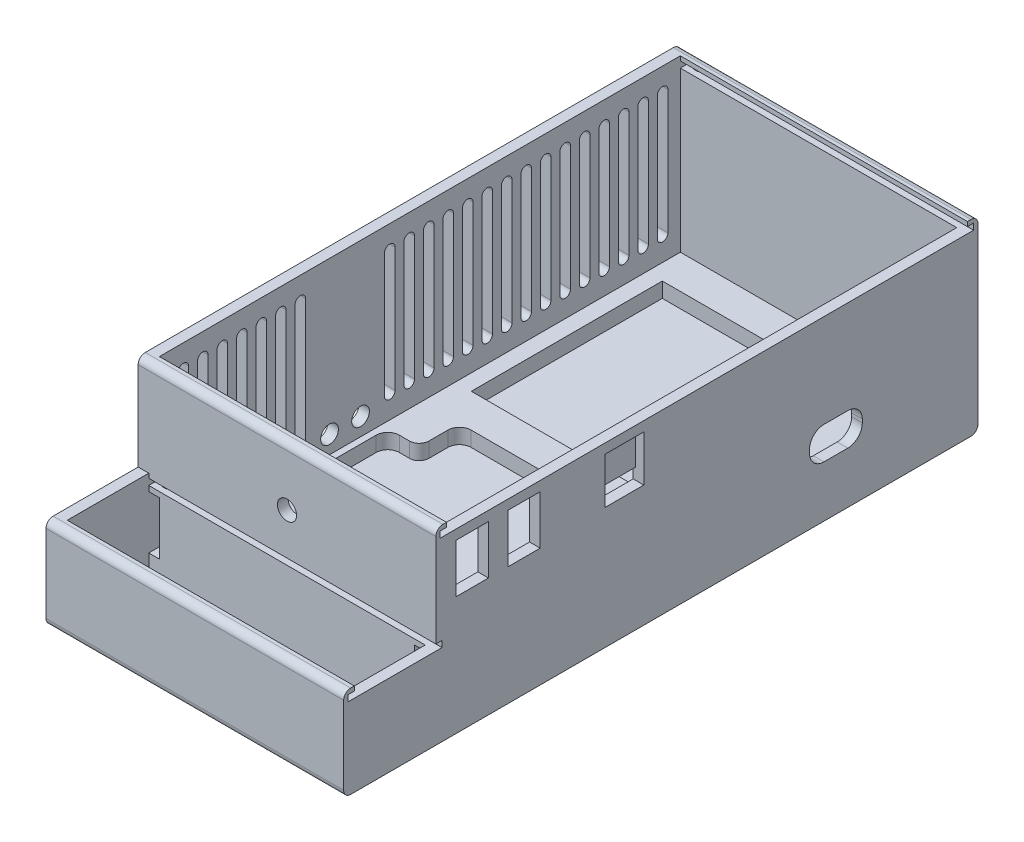
from build123d import *

# Parameters (mm, degrees)
SKETCH1_W            = 100
SKETCH1_H            = 187
BOSS_EXTRUDE1_DEPTH  = 5
SKETCH2_W            = 78
SKETCH2_H            = 23
CUT_EXTRUDE1_DEPTH   = 2.5
SKETCH3_W            = 84
SKETCH3_H            = 29
SKETCH3_W_2          = 78
SKETCH3_H_2          = 23
BOSS_EXTRUDE2_DEPTH  = 18
CUT_EXTRUDE2_DEPTH   = 4.25
CUT_EXTRUDE3_DEPTH   = 0.5
SKETCH8_W            = 3
SKETCH8_H            = 15
CUT_EXTRUDE4_DEPTH   = 3
SKETCH9_W            = 29
SKETCH9_H            = 3
BOSS_EXTRUDE4_DEPTH  = 3
BOSS_EXTRUDE5_DEPTH  = 81
CUT_EXTRUDE5_DEPTH   = 5
BOSS_EXTRUDE6_DEPTH  = 45
SKETCH14_W           = 68.5
SKETCH14_H           = 53.4
CUT_EXTRUDE6_DEPTH   = 4.25
SKETCH15_W           = 84
SKETCH15_H           = 3
BOSS_EXTRUDE7_DEPTH  = 24
BOSS_EXTRUDE8_DEPTH  = 3
SKETCH19_W           = 1.75
SKETCH19_H           = 1.75
CUT_EXTRUDE8_DEPTH   = 81
SKETCH23_W           = 1.75
SKETCH23_H           = 1.25
BOSS_EXTRUDE9_DEPTH  = 0.4
FILLET2_R            = 0.4
SKETCH40_W           = 1.75
SKETCH40_H           = 1.25
BOSS_EXTRUDE14_DEPTH = 0.4
FILLET6_R            = 0.4
SKETCH25_W           = 1.75
SKETCH25_H           = 1.25
BOSS_EXTRUDE11_DEPTH = 0.4
FILLET4_R            = 0.4
SKETCH26_W           = 1.75
SKETCH26_H           = 1.25
BOSS_EXTRUDE12_DEPTH = 0.4
FILLET5_R            = 0.4
SKETCH27_W           = 10.45
SKETCH27_H           = 12.5
CUT_EXTRUDE10_DEPTH  = 3
SKETCH29_W           = 8.6
SKETCH29_H           = 13.3
CUT_EXTRUDE11_DEPTH  = 3
SKETCH30_R           = 2.5
CUT_EXTRUDE12_DEPTH  = 3
CUT_EXTRUDE13_DEPTH  = 3
SKETCH33_R           = 2.5
CUT_EXTRUDE15_DEPTH  = 3
SKETCH34_W           = 69
SKETCH34_H           = 53.9
CUT_EXTRUDE16_DEPTH  = 4.25
SKETCH36_W           = 10.95
SKETCH36_H           = 13
SKETCH36_W_2         = 9.1
SKETCH36_H_2         = 13.8
CUT_EXTRUDE18_DEPTH  = 3
SKETCH37_R           = 2.7
CUT_EXTRUDE19_DEPTH  = 3
SKETCH38_W           = 10.95
SKETCH38_H           = 9.86
BOSS_EXTRUDE13_DEPTH = 0.6
CUT_EXTRUDE20_DEPTH  = 3
FILLET18_R           = 2


with BuildPart() as part:
    # Sketch1 → Boss-Extrude1 (new body)
    with BuildSketch(Plane(origin=(0, 0, 0), x_dir=(1, 0, 0), z_dir=(0, 1, 0))):
        with Locations((50, 93.5)):
            Rectangle(SKETCH1_W, SKETCH1_H)
    extrude(amount=-BOSS_EXTRUDE1_DEPTH)

    # Sketch2 → Cut-Extrude1 (cut)
    with BuildSketch(Plane(origin=(0, 0, 0), x_dir=(1, 0, 0), z_dir=(0, 1, 0))):
        with Locations((50, 22.5)):
            Rectangle(SKETCH2_W, SKETCH2_H)
    extrude(amount=-CUT_EXTRUDE1_DEPTH, mode=Mode.SUBTRACT)

    # Sketch3 → Boss-Extrude2 (add)
    with BuildSketch(Plane(origin=(0, 0, 0), x_dir=(1, 0, 0), z_dir=(0, 1, 0))):
        with Locations((50, 22.5)):
            Rectangle(SKETCH3_W, SKETCH3_H)
        with Locations((50, 22.5)):
            Rectangle(SKETCH3_W_2, SKETCH3_H_2, mode=Mode.SUBTRACT)
    extrude(amount=BOSS_EXTRUDE2_DEPTH)

    # Sketch4 → Cut-Extrude2 (cut)
    with BuildSketch(Plane(origin=(0, 0, 0), x_dir=(1, 0, 0), z_dir=(0, 1, 0))):
        with BuildLine():
            Line((31.915, 47), (76.965, 47))
            ThreePointArc((76.965, 47), (84.036067812, 49.928932188), (86.965, 57))
            Line((86.965, 57), (86.965, 100.77))
            ThreePointArc((86.965, 100.77), (84.036067812, 107.841067812), (76.965, 110.77))
            Line((76.965, 110.77), (24.915, 110.77))
            ThreePointArc((24.915, 110.77), (22.793679656, 109.891320344), (21.915, 107.77))
            Line((21.915, 107.77), (21.915, 102.4))
            ThreePointArc((21.915, 102.4), (21.036320344, 100.278679656), (18.915, 99.4))
            Line((18.915, 99.4), (16.035, 99.4))
            ThreePointArc((16.035, 99.4), (13.913679656, 98.521320344), (13.035, 96.4))
            Line((13.035, 96.4), (13.035, 82.01))
            ThreePointArc((13.035, 82.01), (13.913679656, 79.888679656), (16.035, 79.01))
            Line((16.035, 79.01), (18.915, 79.01))
            ThreePointArc((18.915, 79.01), (21.036320344, 78.131320344), (21.915, 76.01))
            Line((21.915, 76.01), (21.915, 57))
            ThreePointArc((21.915, 57), (24.843932188, 49.928932188), (31.915, 47))
        make_face()
    extrude(amount=-CUT_EXTRUDE2_DEPTH, mode=Mode.SUBTRACT)

    # Sketch7 → Cut-Extrude3 (cut)
    with BuildSketch(Plane(origin=(0, -2.5, 0), x_dir=(1, 0, 0), z_dir=(0, 1, 0))):
        Polygon((11, 34), (34, 11), (32.978260085, 11), (11, 32.978260085), align=None)
        Polygon((12, 34), (35, 11), (36, 11), (13, 34), align=None)
        Polygon((11, 11), (11.521721863, 11), (11, 11.521721863), align=None)
        Polygon((89, 34), (89, 33), (88, 34), align=None)
        Polygon((14, 34), (37, 11), (38, 11), (15, 34), align=None)
        Polygon((16, 34), (39, 11), (40, 11), (17, 34), align=None)
        Polygon((18, 34), (41, 11), (42, 11), (19, 34), align=None)
        Polygon((20, 34), (43, 11), (44, 11), (21, 34), align=None)
        Polygon((22, 34), (45, 11), (46, 11), (23, 34), align=None)
        Polygon((24, 34), (47, 11), (48, 11), (25, 34), align=None)
        Polygon((26, 34), (49, 11), (50, 11), (27, 34), align=None)
        Polygon((28, 34), (51, 11), (52, 11), (29, 34), align=None)
        Polygon((30, 34), (53, 11), (54, 11), (31, 34), align=None)
        Polygon((32, 34), (55, 11), (56, 11), (33, 34), align=None)
        Polygon((34, 34), (57, 11), (58, 11), (35, 34), align=None)
        Polygon((36, 34), (59, 11), (60, 11), (37, 34), align=None)
        Polygon((38, 34), (61, 11), (62, 11), (39, 34), align=None)
        Polygon((40, 34), (63, 11), (64, 11), (41, 34), align=None)
        Polygon((42, 34), (65, 11), (66, 11), (43, 34), align=None)
        Polygon((44, 34), (67, 11), (68, 11), (45, 34), align=None)
        Polygon((46, 34), (69, 11), (70, 11), (47, 34), align=None)
        Polygon((48, 34), (71, 11), (72, 11), (49, 34), align=None)
        Polygon((50, 34), (73, 11), (74, 11), (51, 34), align=None)
        Polygon((52, 34), (75, 11), (76, 11), (53, 34), align=None)
        Polygon((54, 34), (77, 11), (78, 11), (55, 34), align=None)
        Polygon((56, 34), (79, 11), (80, 11), (57, 34), align=None)
        Polygon((58, 34), (81, 11), (82, 11), (59, 34), align=None)
        Polygon((60, 34), (83, 11), (84, 11), (61, 34), align=None)
        Polygon((62, 34), (85, 11), (86, 11), (63, 34), align=None)
        Polygon((64, 34), (87, 11), (88, 11), (65, 34), align=None)
        Polygon((66, 34), (89, 11), (89, 12), (67, 34), align=None)
        Polygon((68, 34), (89, 13), (89, 14), (69, 34), align=None)
        Polygon((70, 34), (89, 15), (89, 16), (71, 34), align=None)
        Polygon((72, 34), (89, 17), (89, 18), (73, 34), align=None)
        Polygon((74, 34), (89, 19), (89, 20), (75, 34), align=None)
        Polygon((76, 34), (89, 21), (89, 22), (77, 34), align=None)
        Polygon((78, 34), (89, 23), (89, 24), (79, 34), align=None)
        Polygon((80, 34), (89, 25), (89, 26), (81, 34), align=None)
        Polygon((82, 34), (89, 27), (89, 28), (83, 34), align=None)
        Polygon((84, 34), (89, 29), (89, 30), (85, 34), align=None)
        Polygon((86, 34), (89, 31), (89, 32), (87, 34), align=None)
        Polygon((11, 31.956520169), (31.956520169, 11), (30.934780254, 11), (11, 30.934780254), align=None)
        Polygon((11, 29.913040339), (29.913040339, 11), (28.891300423, 11), (11, 28.891300423), align=None)
        Polygon((11, 27.869560508), (27.869560508, 11), (26.847820593, 11), (11, 26.847820593), align=None)
        Polygon((11, 25.826080677), (25.826080677, 11), (24.804340762, 11), (11, 24.804340762), align=None)
        Polygon((11, 23.782600847), (23.782600847, 11), (22.760860931, 11), (11, 22.760860931), align=None)
        Polygon((11, 21.739121016), (21.739121016, 11), (20.717381101, 11), (11, 20.717381101), align=None)
        Polygon((11, 19.695641185), (19.695641185, 11), (18.67390127, 11), (11, 18.67390127), align=None)
        Polygon((11, 17.652161355), (17.652161355, 11), (16.630421439, 11), (11, 16.630421439), align=None)
        Polygon((11, 15.608681524), (15.608681524, 11), (14.586941609, 11), (11, 14.586941609), align=None)
        Polygon((11, 13.565201693), (13.565201693, 11), (12.543461778, 11), (11, 12.543461778), align=None)
    extrude(amount=-CUT_EXTRUDE3_DEPTH, mode=Mode.SUBTRACT)

    # Sketch8 → Cut-Extrude4 (cut)
    with BuildSketch(Plane(origin=(0, 0, -37), x_dir=(-1, 0, 0), z_dir=(0, 0, -1))):
        with Locations((-87.5, 9)):
            Rectangle(SKETCH8_W, SKETCH8_H)
        with Locations((-12.5, 9)):
            Rectangle(SKETCH8_W, SKETCH8_H)
    extrude(amount=-CUT_EXTRUDE4_DEPTH, mode=Mode.SUBTRACT)

    # Sketch9 → Boss-Extrude4 (add)
    with BuildSketch(Plane.ZY.offset(-8)):
        with Locations((-22.5, 19.5)):
            Rectangle(SKETCH9_W, SKETCH9_H)
    extrude(amount=-BOSS_EXTRUDE4_DEPTH)

    # Sketch10 → Boss-Extrude5 (add)
    with BuildSketch(Plane(origin=(11, 0, 0), x_dir=(0, 0, -1), z_dir=(1, 0, 0))):
        Polygon((9.25, 18), (8, 18), (8, 21), (11, 21), (11, 19.75), (9.25, 19.75), align=None)
        Polygon((35.75, 19.75), (35.75, 18), (37, 18), (37, 21), (34, 21), (34, 19.75), align=None)
    extrude(amount=BOSS_EXTRUDE5_DEPTH)

    # Sketch12 → Cut-Extrude5 (cut)
    with BuildSketch(Plane(origin=(0, 0, 0), x_dir=(1, 0, 0), z_dir=(0, 1, 0))):
        Polygon((0, 0), (100, 0), (100, 187), (92, 187), (92, 8), (8, 8), (8, 187), (0, 187), align=None)
    extrude(amount=-CUT_EXTRUDE5_DEPTH, mode=Mode.SUBTRACT)

    # Sketch13 → Boss-Extrude6 (add)
    with BuildSketch(Plane(origin=(0, 0, 0), x_dir=(1, 0, 0), z_dir=(0, 1, 0))):
        Polygon((8, 37), (8, 187), (92, 187), (92, 37), (89, 37), (89, 40), (89, 184), (11, 184), (11, 40), (11, 37), align=None)
    extrude(amount=BOSS_EXTRUDE6_DEPTH)

    # Sketch14 → Cut-Extrude6 (cut)
    with BuildSketch(Plane(origin=(0, 0, 0), x_dir=(1, 0, 0), z_dir=(0, 1, 0))):
        with Locations((50, 147.47)):
            Rectangle(SKETCH14_W, SKETCH14_H)
    extrude(amount=-CUT_EXTRUDE6_DEPTH, mode=Mode.SUBTRACT)

    # Sketch15 → Boss-Extrude7 (add)
    with BuildSketch(Plane(origin=(0, 21, 0), x_dir=(1, 0, 0), z_dir=(0, 1, 0))):
        with Locations((50, 35.5)):
            Rectangle(SKETCH15_W, SKETCH15_H)
    extrude(amount=BOSS_EXTRUDE7_DEPTH)

    # Sketch16 → Boss-Extrude8 (add)
    with BuildSketch(Plane(origin=(0, 45, 0), x_dir=(1, 0, 0), z_dir=(0, 1, 0))):
        Polygon((92, 34), (8, 34), (8, 187), (92, 187), (92, 184), (11, 184), (11, 37), (92, 37), align=None)
    extrude(amount=BOSS_EXTRUDE8_DEPTH)

    # Sketch19 → Cut-Extrude8 (cut)
    with BuildSketch(Plane(origin=(92, 0, 0), x_dir=(0, 0, -1), z_dir=(1, 0, 0))):
        with Locations((36.125, 45.875)):
            Rectangle(SKETCH19_W, SKETCH19_H)
        with Locations((184.875, 45.875)):
            Rectangle(SKETCH19_W, SKETCH19_H)
    extrude(amount=-CUT_EXTRUDE8_DEPTH, mode=Mode.SUBTRACT)

    # Sketch23 → Boss-Extrude9 (add)
    with BuildSketch(Plane(origin=(0, 0, -9.25), x_dir=(-1, 0, 0), z_dir=(0, 0, -1))):
        with Locations((-14, 18.875)):
            Rectangle(SKETCH23_W, SKETCH23_H)
    extrude(amount=BOSS_EXTRUDE9_DEPTH)

    # Fillet2
    fillet2_edges = [part.edges().sort_by_distance(p)[0] for p in [
        (13.125, 18.875, -9.65),
        (14.875, 18.875, -9.65),
    ]]
    fillet(fillet2_edges, radius=FILLET2_R - 0.0001)  # a hair under: the kernel refuses the full size

    # Sketch40 → Boss-Extrude14 (add)
    with BuildSketch(Plane.XY.offset(-35.75)):
        with Locations((14, 18.875)):
            Rectangle(SKETCH40_W, SKETCH40_H)
    extrude(amount=BOSS_EXTRUDE14_DEPTH)

    # Fillet6
    fillet6_edges = [part.edges().sort_by_distance(p)[0] for p in [
        (14.875, 18.875, -35.35),
        (13.125, 18.875, -35.35),
    ]]
    fillet(fillet6_edges, radius=FILLET6_R - 0.0001)  # a hair under: the kernel refuses the full size

    # Sketch25 → Boss-Extrude11 (add)
    with BuildSketch(Plane(origin=(0, 0, -35.25), x_dir=(-1, 0, 0), z_dir=(0, 0, -1))):
        with Locations((-14, 45.875)):
            Rectangle(SKETCH25_W, SKETCH25_H)
    extrude(amount=BOSS_EXTRUDE11_DEPTH)

    # Fillet4
    fillet4_edges = [part.edges().sort_by_distance(p)[0] for p in [
        (13.125, 45.875, -35.65),
        (14.875, 45.875, -35.65),
    ]]
    fillet(fillet4_edges, radius=FILLET4_R - 0.0001)  # a hair under: the kernel refuses the full size

    # Sketch26 → Boss-Extrude12 (add)
    with BuildSketch(Plane.XY.offset(-185.75)):
        with Locations((14, 45.875)):
            Rectangle(SKETCH26_W, SKETCH26_H)
    extrude(amount=BOSS_EXTRUDE12_DEPTH)

    # Fillet5
    fillet5_edges = [part.edges().sort_by_distance(p)[0] for p in [
        (13.125, 45.875, -185.35),
        (14.875, 45.875, -185.35),
    ]]
    fillet(fillet5_edges, radius=FILLET5_R - 0.0001)  # a hair under: the kernel refuses the full size

    # Sketch27 → Cut-Extrude10 (cut)
    with BuildSketch(Plane(origin=(92, 0, 0), x_dir=(0, 0, -1), z_dir=(1, 0, 0))):
        with Locations((87.225, 35.75)):
            Rectangle(SKETCH27_W, SKETCH27_H)
    extrude(amount=-CUT_EXTRUDE10_DEPTH, mode=Mode.SUBTRACT)

    # Sketch29 → Cut-Extrude11 (cut)
    with BuildSketch(Plane(origin=(92, 0, 0), x_dir=(0, 0, -1), z_dir=(1, 0, 0))):
        with Locations((44.3, 35.35)):
            Rectangle(SKETCH29_W, SKETCH29_H)
        with Locations((58.9, 35.35)):
            Rectangle(SKETCH29_W, SKETCH29_H)
    extrude(amount=-CUT_EXTRUDE11_DEPTH, mode=Mode.SUBTRACT)

    # Sketch30 → Cut-Extrude12 (cut)
    with BuildSketch(Plane.XY.offset(-34)):
        with Locations((50, 31.5)):
            Circle(SKETCH30_R)
    extrude(amount=-CUT_EXTRUDE12_DEPTH, mode=Mode.SUBTRACT)

    # Sketch31 → Cut-Extrude13 (cut)
    with BuildSketch(Plane(origin=(92, 0, 0), x_dir=(0, 0, -1), z_dir=(1, 0, 0))):
        with BuildLine():
            Line((143.55, 12.5), (150.25, 12.5))
            ThreePointArc((150.25, 12.5), (151.027817459, 12.822182541), (151.35, 13.6))
            Line((151.35, 13.6), (151.35, 14.55))
            ThreePointArc((151.35, 14.55), (151.027817459, 15.327817459), (150.25, 15.65))
            Line((150.25, 15.65), (143.55, 15.65))
            ThreePointArc((143.55, 15.65), (142.772182541, 15.327817459), (142.45, 14.55))
            Line((142.45, 14.55), (142.45, 13.6))
            ThreePointArc((142.45, 13.6), (142.772182541, 12.822182541), (143.55, 12.5))
        make_face()
    extrude(amount=-CUT_EXTRUDE13_DEPTH, mode=Mode.SUBTRACT)

    # Sketch33 → Cut-Extrude15 (cut)
    with BuildSketch(Plane(origin=(11, 0, 0), x_dir=(0, 0, -1), z_dir=(1, 0, 0))):
        with Locations((85.01, 5)):
            Circle(SKETCH33_R)
        with Locations((93.76, 5)):
            Circle(SKETCH33_R)
        with BuildLine():
            Line((177.5, 6.5), (177.5, 41.5))
            ThreePointArc((177.5, 41.5), (179, 43), (180.5, 41.5))
            Line((180.5, 41.5), (180.5, 6.5))
            ThreePointArc((180.5, 6.5), (179, 5), (177.5, 6.5))
        make_face()
        with BuildLine():
            Line((172, 6.5), (172, 41.5))
            ThreePointArc((172, 41.5), (173.5, 43), (175, 41.5))
            Line((175, 41.5), (175, 6.5))
            ThreePointArc((175, 6.5), (173.5, 5), (172, 6.5))
        make_face()
        with BuildLine():
            Line((166.5, 6.5), (166.5, 41.5))
            ThreePointArc((166.5, 41.5), (168, 43), (169.5, 41.5))
            Line((169.5, 41.5), (169.5, 6.5))
            ThreePointArc((169.5, 6.5), (168, 5), (166.5, 6.5))
        make_face()
        with BuildLine():
            Line((161, 6.5), (161, 41.5))
            ThreePointArc((161, 41.5), (162.5, 43), (164, 41.5))
            Line((164, 41.5), (164, 6.5))
            ThreePointArc((164, 6.5), (162.5, 5), (161, 6.5))
        make_face()
        with BuildLine():
            Line((155.5, 6.5), (155.5, 41.5))
            ThreePointArc((155.5, 41.5), (157, 43), (158.5, 41.5))
            Line((158.5, 41.5), (158.5, 6.5))
            ThreePointArc((158.5, 6.5), (157, 5), (155.5, 6.5))
        make_face()
        with BuildLine():
            Line((150, 6.5), (150, 41.5))
            ThreePointArc((150, 41.5), (151.5, 43), (153, 41.5))
            Line((153, 41.5), (153, 6.5))
            ThreePointArc((153, 6.5), (151.5, 5), (150, 6.5))
        make_face()
        with BuildLine():
            Line((144.5, 6.5), (144.5, 41.5))
            ThreePointArc((144.5, 41.5), (146, 43), (147.5, 41.5))
            Line((147.5, 41.5), (147.5, 6.5))
            ThreePointArc((147.5, 6.5), (146, 5), (144.5, 6.5))
        make_face()
        with BuildLine():
            Line((139, 6.5), (139, 41.5))
            ThreePointArc((139, 41.5), (140.5, 43), (142, 41.5))
            Line((142, 41.5), (142, 6.5))
            ThreePointArc((142, 6.5), (140.5, 5), (139, 6.5))
        make_face()
        with BuildLine():
            Line((133.5, 6.5), (133.5, 41.5))
            ThreePointArc((133.5, 41.5), (135, 43), (136.5, 41.5))
            Line((136.5, 41.5), (136.5, 6.5))
            ThreePointArc((136.5, 6.5), (135, 5), (133.5, 6.5))
        make_face()
        with BuildLine():
            Line((128, 6.5), (128, 41.5))
            ThreePointArc((128, 41.5), (129.5, 43), (131, 41.5))
            Line((131, 41.5), (131, 6.5))
            ThreePointArc((131, 6.5), (129.5, 5), (128, 6.5))
        make_face()
        with BuildLine():
            Line((122.5, 6.5), (122.5, 41.5))
            ThreePointArc((122.5, 41.5), (124, 43), (125.5, 41.5))
            Line((125.5, 41.5), (125.5, 6.5))
            ThreePointArc((125.5, 6.5), (124, 5), (122.5, 6.5))
        make_face()
        with BuildLine():
            Line((117, 6.5), (117, 41.5))
            ThreePointArc((117, 41.5), (118.5, 43), (120, 41.5))
            Line((120, 41.5), (120, 6.5))
            ThreePointArc((120, 6.5), (118.5, 5), (117, 6.5))
        make_face()
        with BuildLine():
            Line((111.5, 6.5), (111.5, 41.5))
            ThreePointArc((111.5, 41.5), (113, 43), (114.5, 41.5))
            Line((114.5, 41.5), (114.5, 6.5))
            ThreePointArc((114.5, 6.5), (113, 5), (111.5, 6.5))
        make_face()
        with BuildLine():
            Line((106, 6.5), (106, 41.5))
            ThreePointArc((106, 41.5), (107.5, 43), (109, 41.5))
            Line((109, 41.5), (109, 6.5))
            ThreePointArc((109, 6.5), (107.5, 5), (106, 6.5))
        make_face()
        with BuildLine():
            Line((100.5, 6.5), (100.5, 41.5))
            ThreePointArc((100.5, 41.5), (102, 43), (103.5, 41.5))
            Line((103.5, 41.5), (103.5, 6.5))
            ThreePointArc((103.5, 6.5), (102, 5), (100.5, 6.5))
        make_face()
        with BuildLine():
            Line((78.27, 6.5), (78.27, 41.5))
            ThreePointArc((78.27, 41.5), (76.77, 43), (75.27, 41.5))
            Line((75.27, 41.5), (75.27, 6.5))
            ThreePointArc((75.27, 6.5), (76.77, 5), (78.27, 6.5))
        make_face()
        with BuildLine():
            Line((72.77, 6.5), (72.77, 41.5))
            ThreePointArc((72.77, 41.5), (71.27, 43), (69.77, 41.5))
            Line((69.77, 41.5), (69.77, 6.5))
            ThreePointArc((69.77, 6.5), (71.27, 5), (72.77, 6.5))
        make_face()
        with BuildLine():
            Line((67.27, 6.5), (67.27, 41.5))
            ThreePointArc((67.27, 41.5), (65.77, 43), (64.27, 41.5))
            Line((64.27, 41.5), (64.27, 6.5))
            ThreePointArc((64.27, 6.5), (65.77, 5), (67.27, 6.5))
        make_face()
        with BuildLine():
            Line((61.77, 6.5), (61.77, 41.5))
            ThreePointArc((61.77, 41.5), (60.27, 43), (58.77, 41.5))
            Line((58.77, 41.5), (58.77, 6.5))
            ThreePointArc((58.77, 6.5), (60.27, 5), (61.77, 6.5))
        make_face()
        with BuildLine():
            Line((56.27, 6.5), (56.27, 41.5))
            ThreePointArc((56.27, 41.5), (54.77, 43), (53.27, 41.5))
            Line((53.27, 41.5), (53.27, 6.5))
            ThreePointArc((53.27, 6.5), (54.77, 5), (56.27, 6.5))
        make_face()
        with BuildLine():
            Line((50.77, 6.5), (50.77, 41.5))
            ThreePointArc((50.77, 41.5), (49.27, 43), (47.77, 41.5))
            Line((47.77, 41.5), (47.77, 6.5))
            ThreePointArc((47.77, 6.5), (49.27, 5), (50.77, 6.5))
        make_face()
        with BuildLine():
            Line((45.27, 6.5), (45.27, 41.5))
            ThreePointArc((45.27, 41.5), (43.77, 43), (42.27, 41.5))
            Line((42.27, 41.5), (42.27, 6.5))
            ThreePointArc((42.27, 6.5), (43.77, 5), (45.27, 6.5))
        make_face()
    extrude(amount=-CUT_EXTRUDE15_DEPTH, mode=Mode.SUBTRACT)

    # Sketch34 → Cut-Extrude16 (cut)
    with BuildSketch(Plane(origin=(0, 0, 0), x_dir=(1, 0, 0), z_dir=(0, 1, 0))):
        with BuildLine():
            Line((87.215, 57), (87.215, 100.77))
            ThreePointArc((87.215, 100.77), (84.212844507, 108.017844507), (76.965, 111.02))
            Line((76.965, 111.02), (24.915, 111.02))
            ThreePointArc((24.915, 111.02), (22.616902961, 110.068097039), (21.665, 107.77))
            Line((21.665, 107.77), (21.665, 102.4))
            ThreePointArc((21.665, 102.4), (20.859543648, 100.455456352), (18.915, 99.65))
            Line((18.915, 99.65), (16.035, 99.65))
            ThreePointArc((16.035, 99.65), (13.736902961, 98.698097039), (12.785, 96.4))
            Line((12.785, 96.4), (12.785, 82.01))
            ThreePointArc((12.785, 82.01), (13.736902961, 79.711902961), (16.035, 78.76))
            Line((16.035, 78.76), (18.915, 78.76))
            ThreePointArc((18.915, 78.76), (20.859543648, 77.954543648), (21.665, 76.01))
            Line((21.665, 76.01), (21.665, 57))
            ThreePointArc((21.665, 57), (24.667155493, 49.752155493), (31.915, 46.75))
            Line((31.915, 46.75), (76.965, 46.75))
            ThreePointArc((76.965, 46.75), (84.212844507, 49.752155493), (87.215, 57))
        make_face()
        with Locations((50, 147.47)):
            Rectangle(SKETCH34_W, SKETCH34_H)
    extrude(amount=-CUT_EXTRUDE16_DEPTH, mode=Mode.SUBTRACT)

    # Sketch36 → Cut-Extrude18 (cut)
    with BuildSketch(Plane(origin=(92, 0, 0), x_dir=(0, 0, -1), z_dir=(1, 0, 0))):
        with Locations((87.225, 35.75)):
            Rectangle(SKETCH36_W, SKETCH36_H)
        with Locations((44.3, 35.35)):
            Rectangle(SKETCH36_W_2, SKETCH36_H_2)
        with Locations((58.9, 35.35)):
            Rectangle(SKETCH36_W_2, SKETCH36_H_2)
    extrude(amount=-CUT_EXTRUDE18_DEPTH, mode=Mode.SUBTRACT)

    # Sketch37 → Cut-Extrude19 (cut)
    with BuildSketch(Plane.XY.offset(-34)):
        with Locations((50, 31.5)):
            Circle(SKETCH37_R)
    extrude(amount=-CUT_EXTRUDE19_DEPTH, mode=Mode.SUBTRACT)

    # Sketch38 → Boss-Extrude13 (add)
    with BuildSketch(Plane.ZY.offset(-89)):
        with Locations((-87.225, 37.32)):
            Rectangle(SKETCH38_W, SKETCH38_H)
    extrude(amount=-BOSS_EXTRUDE13_DEPTH)

    # Sketch39 → Cut-Extrude20 (cut)
    with BuildSketch(Plane(origin=(92, 0, 0), x_dir=(0, 0, -1), z_dir=(1, 0, 0))):
        with BuildLine():
            Line((154.35, 13.6), (154.35, 14.55))
            ThreePointArc((154.35, 14.55), (153.149137803, 17.449137803), (150.25, 18.65))
            Line((150.25, 18.65), (143.55, 18.65))
            ThreePointArc((143.55, 18.65), (140.650862197, 17.449137803), (139.45, 14.55))
            Line((139.45, 14.55), (139.45, 13.6))
            ThreePointArc((139.45, 13.6), (140.650862197, 10.700862197), (143.55, 9.5))
            Line((143.55, 9.5), (150.25, 9.5))
            ThreePointArc((150.25, 9.5), (153.149137803, 10.700862197), (154.35, 13.6))
        make_face()
    extrude(amount=-CUT_EXTRUDE20_DEPTH, mode=Mode.SUBTRACT)

    # Fillet18
    fillet18_edges = [part.edges().sort_by_distance(p)[0] for p in [
        (50, 21, -8),
        (50, -5, -187),
        (50, -5, -8),
        (50, 48, -187),
        (50, 48, -34),
    ]]
    fillet(fillet18_edges, radius=FILLET18_R)


solid = part.part
